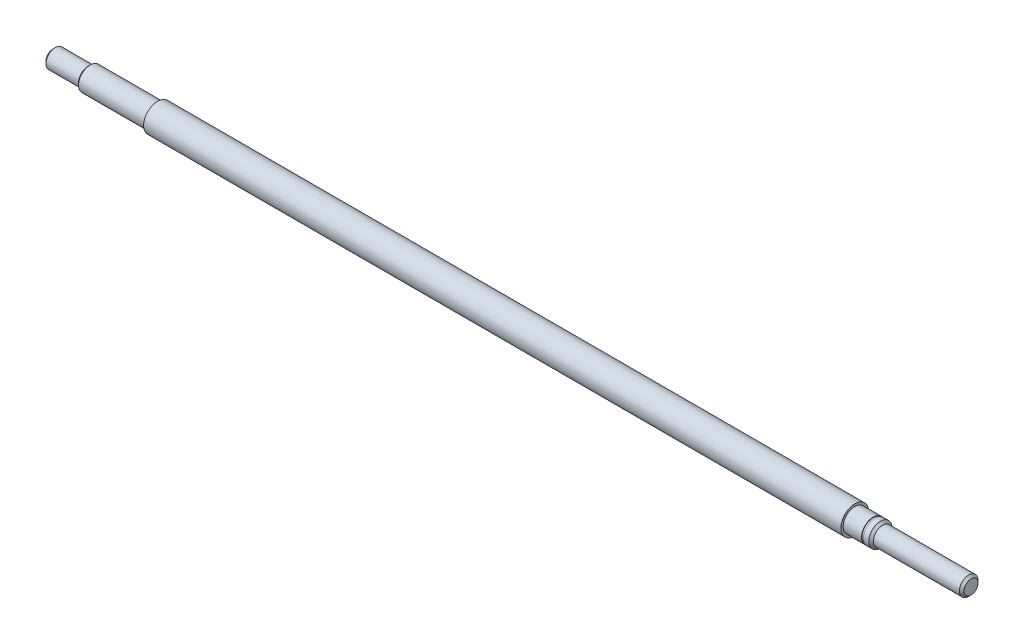
from build123d import *

# Parameters (mm, degrees)
SKETCH_1_W     = 38
SKETCH_1_H     = 4
CHAMFER_1_SIZE = 1


with BuildPart() as part:
    # 草图1 → 旋转1 (revolve)
    with BuildSketch(Plane.XY, mode=Mode.PRIVATE) as revolve_1_sk:
        Polygon((0, 0), (0, 4), (15, 4), (15, 5), (45, 5), (45, 6), (345, 6), (345, 5), (352.9, 5), (352.9, 4.8), (353.7, 4.8), (353.7, 5), (357, 5), (357, 0), align=None)
        with Locations((376, 2)):
            Rectangle(SKETCH_1_W, SKETCH_1_H)
    revolve(revolve_1_sk.sketch.rotate(Axis((0, 0, 0), (1, 0, 0)), 90), axis=Axis((0, 0, 0), (1, 0, 0)))

    # 倒角1
    chamfer_1_edges = [part.edges().sort_by_distance(p)[0] for p in [
        (0, 0, -4),
        (15, 0, -5),
        (357, 0, -5),
        (395, 0, -4),
    ]]
    chamfer(chamfer_1_edges, length=CHAMFER_1_SIZE - 0.0001)  # a hair under: the kernel refuses the full size


solid = part.part
